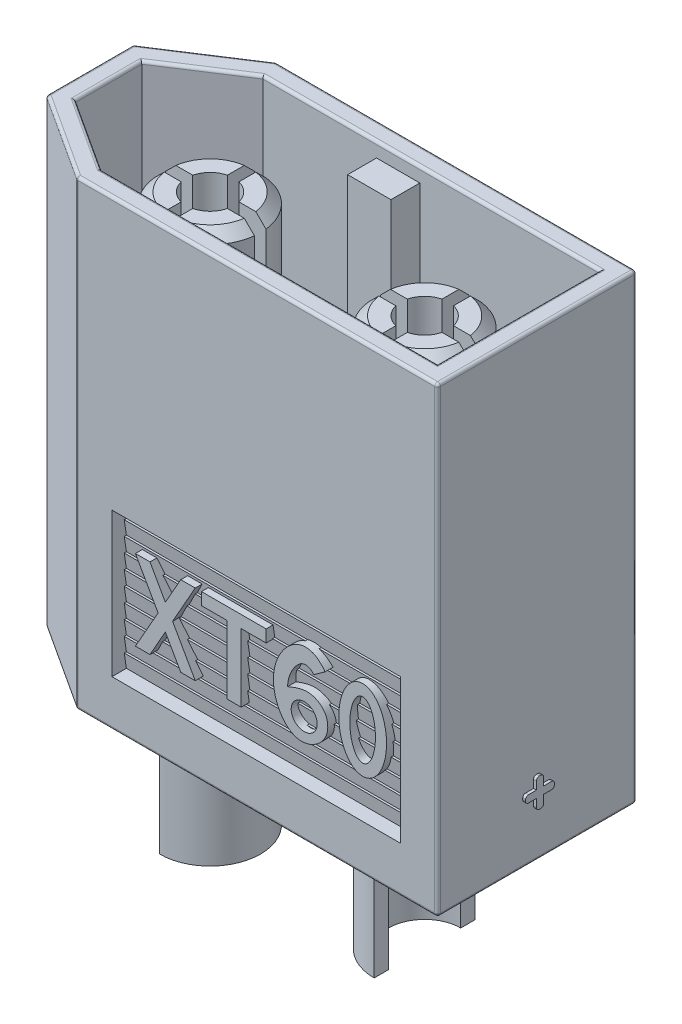
from build123d import *

# Parameters (mm, degrees)
BOSS_EXTRUDE1_DEPTH      = 406.4
CUT_EXTRUDE2_DEPTH       = 215.9
SKETCH5_R                = 69.85
CUT_EXTRUDE3_DEPTH       = 76.2
BOSS_EXTRUDE2_DEPTH      = 2.54
BOSS_EXTRUDE2_DEPTH_BACK = 121.92
SKETCH6_R                = 47.625
BOSS_EXTRUDE3_DEPTH      = 190.5
BOSS_EXTRUDE3_DEPTH_BACK = 292.1
SKETCH7_R                = 44.45
CHAMFER2_SIZE            = 7.567635313
CHAMFER2_SIZE_2          = 6.35
CUT_EXTRUDE4_DEPTH       = 95.25
SKETCH9_R                = 31.75
CUT_EXTRUDE5_DEPTH       = 170.942
SKETCH10_R               = 20.955
CUT_EXTRUDE6_DEPTH       = 610.362
CUT_EXTRUDE7_DEPTH       = 127
SKETCH13_W               = 38.1
SKETCH13_H               = 142.24
CUT_EXTRUDE8_DEPTH       = 43.18
SKETCH14_W               = 38.1
SKETCH14_H               = 25.4
BOSS_EXTRUDE4_DEPTH      = 246.38
FILLET1_R                = 2.54
BOSS_EXTRUDE5_DEPTH      = 2.54
FILLET3_R                = 2.54
SKETCH16_W               = 25.4
SKETCH16_H               = 6.35
BOSS_EXTRUDE6_DEPTH      = 2.54
FILLET4_R                = 2.54
SKETCH17_W               = 254
SKETCH17_H               = 127
CUT_EXTRUDE9_DEPTH       = 12.7
SKETCH18_W               = 254
SKETCH18_H               = 127
CUT_EXTRUDE10_DEPTH      = 12.7
BOSS_EXTRUDE8_DEPTH      = 254
SKETCH24_R               = 11.451862985
SKETCH24_RX              = 35.369486153
SKETCH24_RY              = 21.024695141
SKETCH24_RX_2            = 25.292382057
SKETCH24_RY_2            = 11.269834248
BOSS_EXTRUDE9_DEPTH      = 7.62
SKETCH26_R               = 11.451862985
SKETCH26_RX              = 35.369486153
SKETCH26_RY              = 21.024695141
SKETCH26_RX_2            = 25.292382057
SKETCH26_RY_2            = 11.269834248
BOSS_EXTRUDE10_DEPTH     = 7.62


with BuildPart() as part:
    # Sketch1 → Boss-Extrude1 (new body)
    with BuildSketch(Plane(origin=(0, 0, 0), x_dir=(1, 0, 0), z_dir=(0, 1, 0))):
        Polygon((-158.75, 87.63), (158.75, 87.63), (158.75, -87.63), (-158.75, -87.63), (-234.95, -38.1), (-234.95, 38.1), align=None)
    extrude(amount=BOSS_EXTRUDE1_DEPTH)

    # Sketch4 → Cut-Extrude2 (cut)
    with BuildSketch(Plane(origin=(0, 406.4, 0), x_dir=(1, 0, 0), z_dir=(0, 1, 0))):
        Polygon((142.24, -71.12), (142.24, 71.12), (-153.855774478, 71.12), (-218.44, 29.14025341), (-218.44, -29.14025341), (-153.855774478, -71.12), align=None)
    extrude(amount=-CUT_EXTRUDE2_DEPTH, mode=Mode.SUBTRACT)

    # Sketch5 → Cut-Extrude3 (cut)
    with BuildSketch(Plane.XZ):
        with Locations(Location((-129.17676265, 0, 0), (0, 0, 270))):
            Circle(SKETCH5_R)
        with Locations(Location((59.724357964, 0, 0), (0, 0, 270))):
            Circle(SKETCH5_R)
    extrude(amount=-CUT_EXTRUDE3_DEPTH, mode=Mode.SUBTRACT)

    # Sketch6 → Boss-Extrude2 (add, two sides: drawn at the far end of the back side and taken through both)
    with BuildSketch(Plane.XZ.offset(-76.2).offset(-BOSS_EXTRUDE2_DEPTH_BACK)):
        with Locations(Location((-129.17676265, 0, 0), (0, 0, 270))):
            Circle(SKETCH6_R)
        with Locations(Location((59.724357964, 0, 0), (0, 0, 270))):
            Circle(SKETCH6_R)
    extrude(amount=BOSS_EXTRUDE2_DEPTH + BOSS_EXTRUDE2_DEPTH_BACK)

    # Sketch7 → Boss-Extrude3 (add, two sides: drawn at the far end of the back side and taken through both)
    with BuildSketch(Plane.XZ.offset(-73.66).offset(-BOSS_EXTRUDE3_DEPTH_BACK)):
        with Locations(Location((-129.17676265, 0, 0), (0, 0, 270))):
            Circle(SKETCH7_R)
        with Locations(Location((59.724357964, 0, 0), (0, 0, 270))):
            Circle(SKETCH7_R)
    extrude(amount=BOSS_EXTRUDE3_DEPTH + BOSS_EXTRUDE3_DEPTH_BACK)

    # Chamfer2
    # the kernel refuses this chamfer: 7.567635313, 6.35 mm, written as the material it takes off along each edge
    with BuildSketch(Plane(origin=(-129.17676265, 198.12, 0), x_dir=(0, 0, -1), z_dir=(-1, 0, 0))) as chamfer2_piece_1_section:
        Polygon((47.625, CHAMFER2_SIZE), (47.625 - CHAMFER2_SIZE_2, 0), (47.625, 0), align=None)
    chamfer2_piece_1 = revolve(axis=Axis((-129.17676265, 198.12, 0), (0, -1, 0)), mode=Mode.PRIVATE)
    chamfer2_piece_1 = chamfer2_piece_1 - Plane(origin=(-129.17676265, 198.12, 0), x_dir=(0, 0, -1), z_dir=(0, -1, 0)) * Cylinder(44.45, 191, mode=Mode.PRIVATE)
    add(chamfer2_piece_1, mode=Mode.SUBTRACT)
    with BuildSketch(Plane(origin=(59.724357964, 198.12, 0), x_dir=(0, 0, -1), z_dir=(-1, 0, 0))) as chamfer2_piece_2_section:
        Polygon((47.625, CHAMFER2_SIZE), (47.625 - CHAMFER2_SIZE_2, 0), (47.625, 0), align=None)
    chamfer2_piece_2 = revolve(axis=Axis((59.724357964, 198.12, 0), (0, -1, 0)), mode=Mode.PRIVATE)
    chamfer2_piece_2 = chamfer2_piece_2 - Plane(origin=(59.724357964, 198.12, 0), x_dir=(0, 0, -1), z_dir=(0, -1, 0)) * Cylinder(44.45, 191, mode=Mode.PRIVATE)
    add(chamfer2_piece_2, mode=Mode.SUBTRACT)

    # Sketch8 → Cut-Extrude4 (cut)
    with BuildSketch(Plane.XZ.offset(116.84)):
        with BuildLine():
            Line((59.724357964, -44.45), (59.724357964, -31.75))
            ThreePointArc((59.724357964, -31.75), (27.974357964, 0), (59.724357964, 31.75))
            Line((59.724357964, 31.75), (59.724357964, 44.45))
            ThreePointArc((59.724357964, 44.45), (104.174357964, 0), (59.724357964, -44.45))
        make_face()
        with BuildLine():
            Line((-129.17676265, -44.45), (-129.17676265, -31.75))
            ThreePointArc((-129.17676265, -31.75), (-97.42676265, 0), (-129.17676265, 31.75))
            Line((-129.17676265, 31.75), (-129.17676265, 44.45))
            ThreePointArc((-129.17676265, 44.45), (-173.62676265, 0), (-129.17676265, -44.45))
        make_face()
    extrude(amount=-CUT_EXTRUDE4_DEPTH, mode=Mode.SUBTRACT)

    # Sketch9 → Cut-Extrude5 (cut)
    with BuildSketch(Plane.XZ.offset(21.59)):
        with Locations(Location((-129.17676265, 0, 0), (0, 0, 270))):
            Circle(SKETCH9_R)
        with Locations(Location((59.724357964, 0, 0), (0, 0, 270))):
            Circle(SKETCH9_R)
    extrude(amount=-CUT_EXTRUDE5_DEPTH, mode=Mode.SUBTRACT)

    # Sketch10 → Cut-Extrude6 (cut)
    with BuildSketch(Plane(origin=(0, 365.76, 0), x_dir=(1, 0, 0), z_dir=(0, 1, 0))):
        with Locations(Location((-129.17676265, 0, 0), (0, 0, 270))):
            Circle(SKETCH10_R)
        with Locations(Location((59.724357964, 0, 0), (0, 0, 270))):
            Circle(SKETCH10_R)
    extrude(amount=-CUT_EXTRUDE6_DEPTH, mode=Mode.SUBTRACT)

    # Chamfer3: read off the stored shape, not the designer's step
    # Chamfer3 outline → Chamfer3 (revolve, cut)
    with BuildSketch(Plane(origin=(-129.17676265, 0, 0), x_dir=(1, 0, 0), z_dir=(0, 0, 1))):
        Polygon((44.45, 365.76), (35.56, 365.76), (44.45, 356.87), align=None)
    revolve(axis=Axis((-129.17676265, 0, 0), (0, 1, 0)), mode=Mode.SUBTRACT)

    # Chamfer4: read off the stored shape, not the designer's step
    # Chamfer4 outline → Chamfer4 (revolve, cut)
    with BuildSketch(Plane(origin=(59.724357964, 0, 0), x_dir=(1, 0, 0), z_dir=(0, 0, 1))):
        Polygon((44.45, 365.76), (35.56, 365.76), (44.45, 356.87), align=None)
    revolve(axis=Axis((59.724357964, 0, 0), (0, 1, 0)), mode=Mode.SUBTRACT)

    # Sketch12 → Cut-Extrude7 (cut)
    with BuildSketch(Plane(origin=(0, 365.76, 0), x_dir=(1, 0, 0), z_dir=(0, 1, 0))):
        Polygon((64.804357964, -5.08), (120.481015582, -5.08), (120.481015582, 5.08), (64.804357964, 5.08), (64.804357964, 61.079334723), (54.644357964, 61.079334723), (54.644357964, 5.08), (-1.032299654, 5.08), (-1.032299654, -5.08), (54.644357964, -5.08), (54.644357964, -61.079334723), (64.804357964, -61.079334723), align=None)
        Polygon((-188.10083986, 5.08), (-134.25676265, 5.08), (-134.25676265, 61.079334723), (-124.09676265, 61.079334723), (-124.09676265, 5.08), (-70.25268544, 5.08), (-70.25268544, -5.08), (-124.09676265, -5.08), (-124.09676265, -61.079334723), (-134.25676265, -61.079334723), (-134.25676265, -5.08), (-188.10083986, -5.08), align=None)
    extrude(amount=-CUT_EXTRUDE7_DEPTH, mode=Mode.SUBTRACT)

    # Sketch13 → Cut-Extrude8 (cut)
    with BuildSketch(Plane(origin=(0, 190.5, 0), x_dir=(1, 0, 0), z_dir=(0, 1, 0))):
        with Locations((-34.726202343, 0)):
            Rectangle(SKETCH13_W, SKETCH13_H)
    extrude(amount=-CUT_EXTRUDE8_DEPTH, mode=Mode.SUBTRACT)

    # Sketch14 → Boss-Extrude4 (add)
    with BuildSketch(Plane(origin=(0, 147.32, 0), x_dir=(1, 0, 0), z_dir=(0, 1, 0))):
        with Locations((-34.726202343, 58.42)):
            Rectangle(SKETCH14_W, SKETCH14_H)
    extrude(amount=BOSS_EXTRUDE4_DEPTH)

    # Fillet1
    fillet1_edges = [part.edges().sort_by_distance(p)[0] for p in [
        (158.75, 203.2, 87.63),
        (-158.75, 203.2, 87.63),
        (-234.95, 203.2, 38.1),
        (-234.95, 203.2, -38.1),
        (-158.75, 203.2, -87.63),
        (158.75, 203.2, -87.63),
        (-196.85, 406.4, -62.865),
        (-234.95, 406.4, 0),
        (-196.85, 406.4, 62.865),
        (-5.807887239, 406.4, 71.12),
        (142.24, 406.4, 0),
        (-5.807887239, 406.4, -71.12),
        (0, 406.4, 87.63),
        (-186.147887239, 406.4, -50.130126705),
        (-218.44, 406.4, 0),
        (-186.147887239, 406.4, 50.130126705),
        (158.75, 406.4, 0),
        (0, 0, 87.63),
        (-196.85, 0, 62.865),
        (-234.95, 0, 0),
        (-196.85, 0, -62.865),
        (0, 0, -87.63),
        (158.75, 0, 0),
        (0, 406.4, -87.63),
    ]]
    fillet(fillet1_edges, radius=FILLET1_R)

    # Sketch15 → Boss-Extrude5 (add)
    with BuildSketch(Plane(origin=(158.75, 0, 0), x_dir=(0, 0, -1), z_dir=(1, 0, 0))):
        Polygon((3.175, 56.515), (12.7, 56.515), (12.7, 50.165), (3.175, 50.165), (3.175, 40.64), (-3.175, 40.64), (-3.175, 50.165), (-12.7, 50.165), (-12.7, 56.515), (-3.175, 56.515), (-3.175, 66.04), (3.175, 66.04), align=None)
    extrude(amount=BOSS_EXTRUDE5_DEPTH)

    # Fillet3
    fillet3_edges = [part.edges().sort_by_distance(p)[0] for p in [
        (160.02, 66.04, 3.175),
        (160.02, 56.515, 12.7),
        (160.02, 50.165, 12.7),
        (160.02, 40.64, 3.175),
        (160.02, 40.64, -3.175),
        (160.02, 50.165, -12.7),
        (160.02, 56.515, -12.7),
        (160.02, 66.04, -3.175),
    ]]
    fillet(fillet3_edges, radius=FILLET3_R)

    # Sketch16 → Boss-Extrude6 (add)
    with BuildSketch(Plane.ZY.offset(234.95)):
        with Locations((0, 53.34)):
            Rectangle(SKETCH16_W, SKETCH16_H)
    extrude(amount=BOSS_EXTRUDE6_DEPTH)

    # Fillet4
    fillet4_edges = [part.edges().sort_by_distance(p)[0] for p in [
        (-236.22, 50.165, 12.7),
        (-236.22, 56.515, 12.7),
        (-236.22, 56.515, -12.7),
        (-236.22, 50.165, -12.7),
    ]]
    fillet(fillet4_edges, radius=FILLET4_R)

    # Sketch17 → Cut-Extrude9 (cut)
    with BuildSketch(Plane(origin=(0, 0, -87.63), x_dir=(-1, 0, 0), z_dir=(0, 0, -1))):
        with Locations((0.893521114, 104.14)):
            Rectangle(SKETCH17_W, SKETCH17_H)
    extrude(amount=-CUT_EXTRUDE9_DEPTH, mode=Mode.SUBTRACT)

    # Sketch18 → Cut-Extrude10 (cut)
    with BuildSketch(Plane.XY.offset(87.63)):
        with Locations((-0.893521114, 104.14)):
            Rectangle(SKETCH18_W, SKETCH18_H)
    extrude(amount=-CUT_EXTRUDE10_DEPTH, mode=Mode.SUBTRACT)

    # Sketch20 → Boss-Extrude8 (add)
    with BuildSketch(Plane.ZY.offset(-126.106478886)):
        Polygon((-76.835, 167.64), (-74.93, 154.94), (-76.835, 154.94), (-74.93, 142.24), (-76.835, 142.24), (-74.93, 129.54), (-76.835, 129.54), (-74.93, 116.84), (-76.835, 116.84), (-74.93, 104.14), (-76.835, 104.14), (-74.93, 91.44), (-76.835, 91.44), (-74.93, 78.74), (-76.835, 78.74), (-74.93, 66.04), (-76.835, 66.04), (-74.93, 53.34), (-76.835, 53.34), (-74.93, 40.64), (-73.054666393, 40.64), (-73.054666393, 167.64), (-74.93, 167.64), align=None)
    boss_extrude8 = extrude(amount=BOSS_EXTRUDE8_DEPTH)

    # Sketch24 → Boss-Extrude9 (add)
    # profile 1 of 4: a face of its own
    with BuildSketch(Plane.XY.offset(74.93)):
        Polygon((-85.973140066, 93.15477366), (-99.511730943, 69.135998041), (-112.333691006, 69.135998041), (-92.364660976, 104.461450404), (-112.333691006, 139.786902766), (-99.511730943, 139.786902766), (-85.973140066, 115.768127147), (-72.395630945, 139.786902766), (-59.68814837, 139.786902766), (-79.599939656, 104.461450404), (-59.68814837, 69.135998041), (-72.395630945, 69.135998041), align=None)
    # profile 2 of 4: a face of its own
    with BuildSketch(Plane.XY.offset(74.93)):
        Polygon((-19.210685616, 69.180031832), (-19.210685616, 129.081464616), (2.744044035, 129.081464616), (2.744044035, 139.830936557), (-19.210685616, 139.830936557), (-31.827688227, 139.830936557), (-54.212620971, 139.830936557), (-54.212620971, 129.081464616), (-31.827688227, 129.081464616), (-31.827688227, 69.180031832), align=None)
    # profile 3 of 4: a face of its own
    with BuildSketch(Plane.XY.offset(74.93)):
        with BuildLine():
            add(Edge.make_bspline(
                [(44.665000154, 125.932086162), (37.834510026, 133.775533741), (25.836759218, 123.886461357), (21.767059251, 111.070828354), (21.619241047, 105.25553147)],
                knots=[0, 0, 0, 0, 0.190849479, 0.355801179, 0.355801179, 0.355801179, 0.355801179], degree=3))
            add(Edge.make_bspline(
                [(54.594090211, 133.007256452), (36.545311932, 158.33639167), (-7.55924821, 116.065299273), (25.437863197, 59.907278266), (57.702623022, 79.085929369), (57.836826937, 102.290083599), (40.161238674, 112.981991729), (28.19278227, 107.925662969), (21.682880211, 105.281735905), (21.619241047, 105.25553147)],
                knots=[0, 0, 0, 0, 0.346902545, 0.566821062, 0.697461154, 0.793699074, 0.867755465, 0.974591234, 0.975653318, 0.975653318, 0.975653318, 0.975653318], degree=3))
            Line((54.594090211, 133.007256452), (44.665000154, 125.932086162))
        make_face()
        with Locations(Location((36.234645788, 89.753782202, 0), (0, 0, 180))):
            Circle(SKETCH24_R, mode=Mode.SUBTRACT)
    # profile 4 of 4: a face of its own
    with BuildSketch(Plane.XY.offset(74.93)):
        with Locations(Location((87.702336331, 105.333820808), (0, 0, -90))):
            Ellipse(SKETCH24_RX, SKETCH24_RY)
        with Locations(Location((87.702336331, 105.333820808), (0, 0, -90))):
            Ellipse(SKETCH24_RX_2, SKETCH24_RY_2, mode=Mode.SUBTRACT)
    extrude(amount=BOSS_EXTRUDE9_DEPTH)

    # Mirror2: Boss-Extrude8 across plane
    add(boss_extrude8.mirror(Plane.XY))

    # Sketch26 → Boss-Extrude10 (add)
    # profile 1 of 4: a face of its own
    with BuildSketch(Plane(origin=(0, 0, -74.93), x_dir=(-1, 0, 0), z_dir=(0, 0, -1))):
        Polygon((-13.440597981, 67.986211024), (-13.440597981, 127.887643808), (8.51413167, 127.887643808), (8.51413167, 138.637115749), (-13.440597981, 138.637115749), (-26.057600592, 138.637115749), (-48.442533336, 138.637115749), (-48.442533336, 127.887643808), (-26.057600592, 127.887643808), (-26.057600592, 67.986211024), align=None)
    # profile 2 of 4: a face of its own
    with BuildSketch(Plane(origin=(0, 0, -74.93), x_dir=(-1, 0, 0), z_dir=(0, 0, -1))):
        with BuildLine():
            add(Edge.make_bspline(
                [(50.435087788, 124.738265354), (43.604597661, 132.581712933), (31.606846853, 122.692640549), (27.537146886, 109.877007546), (27.389328682, 104.061710662)],
                knots=[0, 0, 0, 0, 0.190849479, 0.355801179, 0.355801179, 0.355801179, 0.355801179], degree=3))
            add(Edge.make_bspline(
                [(60.364177846, 131.813435644), (42.315399567, 157.142570862), (-1.789160576, 114.871478465), (31.207950832, 58.713457458), (63.472710657, 77.892108562), (63.606914572, 101.096262791), (45.931326309, 111.788170921), (33.962869905, 106.731842161), (27.452967846, 104.087915097), (27.389328682, 104.061710662)],
                knots=[0, 0, 0, 0, 0.346902545, 0.566821062, 0.697461154, 0.793699074, 0.867755465, 0.974591234, 0.975653318, 0.975653318, 0.975653318, 0.975653318], degree=3))
            Line((60.364177846, 131.813435644), (50.435087788, 124.738265354))
        make_face()
        with Locations(Location((42.004733422, 88.559961394, 0), (0, 0, 165.434250223))):
            Circle(SKETCH26_R, mode=Mode.SUBTRACT)
    # profile 3 of 4: a face of its own
    with BuildSketch(Plane(origin=(0, 0, -74.93), x_dir=(-1, 0, 0), z_dir=(0, 0, -1))):
        with Locations(Location((93.472423965, 104.14), (0, 0, -90))):
            Ellipse(SKETCH26_RX, SKETCH26_RY)
        with Locations(Location((93.472423965, 104.14), (0, 0, -90))):
            Ellipse(SKETCH26_RX_2, SKETCH26_RY_2, mode=Mode.SUBTRACT)
    # profile 4 of 4: a face of its own
    with BuildSketch(Plane(origin=(0, 0, -74.93), x_dir=(-1, 0, 0), z_dir=(0, 0, -1))):
        Polygon((-86.594573341, 103.267629596), (-106.563603371, 67.942177233), (-93.741643308, 67.942177233), (-80.203052431, 91.960952853), (-66.625543311, 67.942177233), (-53.918060735, 67.942177233), (-73.829852021, 103.267629596), (-53.918060735, 138.593081958), (-66.625543311, 138.593081958), (-80.203052431, 114.574306339), (-93.741643308, 138.593081958), (-106.563603371, 138.593081958), align=None)
    extrude(amount=BOSS_EXTRUDE10_DEPTH)


solid = part.part
